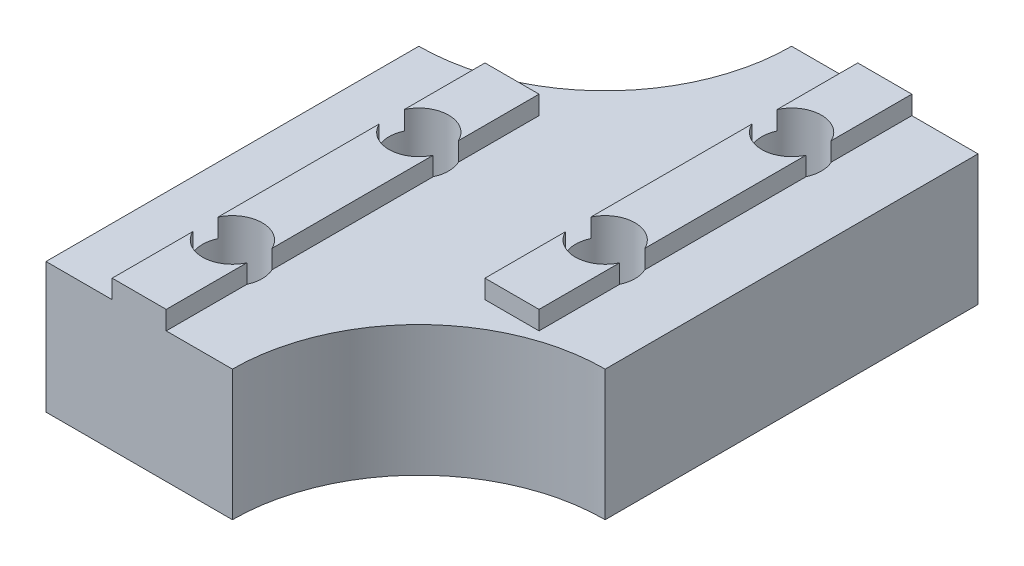
from build123d import *

# Parameters (mm, degrees)
MAIN_DEPTH                = 10
ESQUISSE2_R               = 1.6
TOPHOLE_DEPTH             = 14.747727085
LPATTERN1_COUNT           = 2
LPATTERN1_PITCH           = 10
LPATTERN2_COUNT           = 2
LPATTERN2_PITCH           = 10
LPATTERN2_2_COUNT         = 2
LPATTERN2_2_PITCH         = 10
LPATTERN3_COUNT           = 2
LPATTERN3_PITCH           = 10
LPATTERN3_COPY_1_DEPTH    = 10
LPATTERN3_COPY_2_SKETCH_R = 1.6
LPATTERN3_COPY_2_DEPTH    = 14.747727085
LPATTERN3_COPY_3_DEPTH    = 10
SKETCH1_W                 = 10
SKETCH1_H                 = 10
CUT_EXTRUDE1_DEPTH        = 27.248809497
FILLET1_R                 = 10
SKETCH2_W                 = 10
SKETCH2_H                 = 10
CUT_EXTRUDE2_DEPTH        = 1


with BuildPart() as part:
    # Esquisse1 → Main (new body)
    with BuildSketch(Plane.XY):
        Polygon((-5, 0), (-5, 7), (-1.45, 7), (-1.45, 8), (1.45, 8), (1.45, 7), (5, 7), (5, 0), align=None)
    main = extrude(amount=MAIN_DEPTH)

    # Esquisse2 → TopHole (cut, through all)
    with BuildSketch(Plane(origin=(0, 8, 0), x_dir=(1, 0, 0), z_dir=(0, 1, 0))):
        with Locations(Location((0, -5, 0), (0, 0, 270))):
            Circle(ESQUISSE2_R)
    tophole = extrude(amount=-TOPHOLE_DEPTH, mode=Mode.SUBTRACT)


with BuildPart() as lpattern1_1:
    # LPattern1: pattern copy
    add(part.part.moved(Location(Vector(0, 0, -1) * (1 * LPATTERN1_PITCH))))


with BuildPart() as part_1:
    add(part.part)

    add(lpattern1_1.part)  # LPattern2 merges LPattern1_1
    # LPattern2: Main ×2
    with Locations(*[(-i * LPATTERN2_PITCH, 0, 0) for i in range(1, LPATTERN2_COUNT)]):
        add(main)

    # LPattern2 2: TopHole ×2
    with Locations(*[(-i * LPATTERN2_2_PITCH, 0, 0) for i in range(1, LPATTERN2_2_COUNT)]):
        add(tophole, mode=Mode.SUBTRACT)

    # LPattern3: TopHole ×2
    with Locations(*[(0, 0, i * LPATTERN3_PITCH) for i in range(1, LPATTERN3_COUNT)]):
        add(tophole, mode=Mode.SUBTRACT)

    # LPattern3 copy 1 sketch → LPattern3 copy 1 (add)
    with BuildSketch(Plane(origin=(-10, 0, 10), x_dir=(1, 0, 0), z_dir=(0, 0, 1))):
        Polygon((-5, 0), (-5, 7), (-1.45, 7), (-1.45, 8), (1.45, 8), (1.45, 7), (5, 7), (5, 0), align=None)
    extrude(amount=LPATTERN3_COPY_1_DEPTH)

    # LPattern3 copy 2 sketch → LPattern3 copy 2 (cut, through all)
    with BuildSketch(Plane(origin=(-10, 8, 10), x_dir=(1, 0, 0), z_dir=(0, 1, 0))):
        with Locations(Location((0, -5, 0), (0, 0, 270))):
            Circle(LPATTERN3_COPY_2_SKETCH_R)
    extrude(amount=-LPATTERN3_COPY_2_DEPTH, mode=Mode.SUBTRACT)

    # LPattern3 copy 3 sketch → LPattern3 copy 3 (add)
    with BuildSketch(Plane.XY.offset(10)):
        Polygon((-5, 0), (-5, 7), (-1.45, 7), (-1.45, 8), (1.45, 8), (1.45, 7), (5, 7), (5, 0), align=None)
    extrude(amount=LPATTERN3_COPY_3_DEPTH)

    # Sketch1 → Cut-Extrude1 (cut, through all)
    with BuildSketch(Plane(origin=(0, 8, 0), x_dir=(1, 0, 0), z_dir=(0, 1, 0))):
        with Locations((0, -15)):
            Rectangle(SKETCH1_W, SKETCH1_H)
    extrude(amount=-CUT_EXTRUDE1_DEPTH, mode=Mode.SUBTRACT)

    # Fillet1
    fillet1_edges = [part_1.edges().sort_by_distance(p)[0] for p in [
        (-5, 3.5, 0),
        (-5, 3.5, 10),
    ]]
    fillet(fillet1_edges, radius=FILLET1_R - 0.0001)  # a hair under: the kernel refuses the full size

    # Sketch2 → Cut-Extrude2 (cut)
    with BuildSketch(Plane(origin=(0, 8, 0), x_dir=(1, 0, 0), z_dir=(0, 1, 0))):
        with Locations((-10, 5)):
            Rectangle(SKETCH2_W, SKETCH2_H)
        with Locations((0, -15)):
            Rectangle(SKETCH2_W, SKETCH2_H)
    extrude(amount=-CUT_EXTRUDE2_DEPTH, mode=Mode.SUBTRACT)


solid = part_1.part
